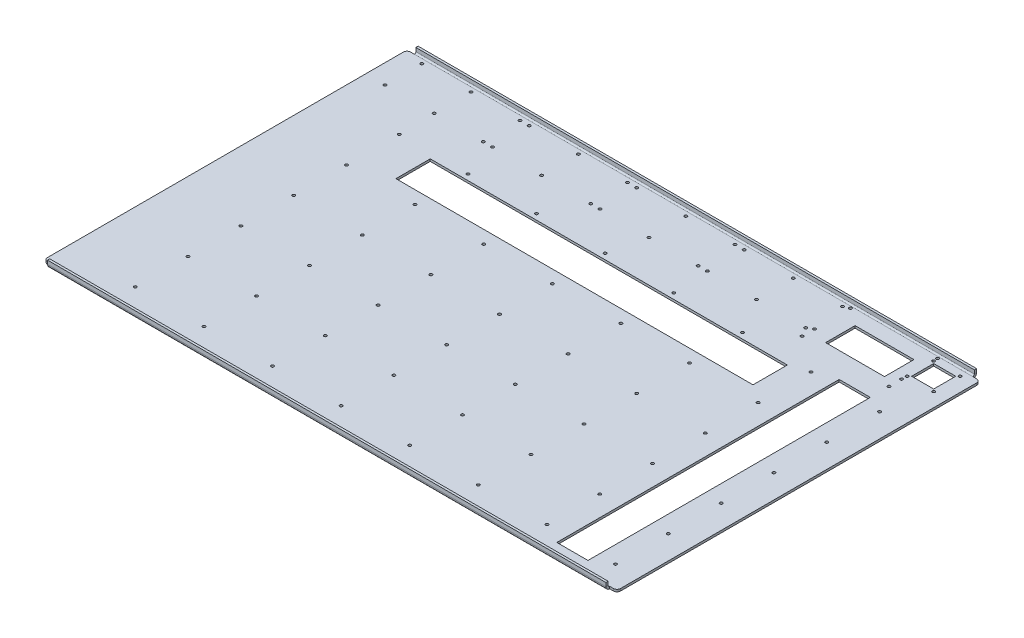
from build123d import *

# Parameters (mm, degrees)
SKETCH1_W                    = 481.838
SKETCH1_H                    = 315.9125
BASE_FLANGE1_DEPTH           = 1.9304
EDGE_FLANGE1_STRIP_W         = 10.2616
EDGE_FLANGE1_STRIP_H         = 1.9304
EDGE_FLANGE1_STRIP_CUT_DEPTH = 481.838
EDGE_FLANGE1_DEPTH           = 481.838
EDGE_FLANGE2_STRIP_W         = 10.2616
EDGE_FLANGE2_STRIP_H         = 1.9304
EDGE_FLANGE2_STRIP_CUT_DEPTH = 481.838
EDGE_FLANGE2_DEPTH           = 481.838
SKETCH11_W                   = 6.35
SKETCH11_H                   = 313.3725
TAB1_DEPTH                   = 1.9304
SKETCH12_W                   = 6.35
SKETCH12_H                   = 313.3725
TAB2_DEPTH                   = 1.9304
BREAK_CORNER1_START          = -1.9304
BREAK_CORNER1_DEPTH          = 1.9304
SKETCH17_R                   = 1.2192
CUT_EXTRUDE2_DEPTH           = 1.9304
SKETCH19_W                   = 19.05
SKETCH19_H                   = 19.05
CUT_EXTRUDE4_DEPTH           = 1.9304
SKETCH20_R                   = 1.2192
CUT_EXTRUDE5_DEPTH           = 1.9304
LPATTERN1_COUNT              = 2
LPATTERN1_PITCH              = 75.0316
LPATTERN1_COUNT_DIR2         = 2
LPATTERN1_PITCH_DIR2         = 30.988
SKETCH21_R                   = 1.2192
CUT_EXTRUDE6_DEPTH           = 1.9304
LPATTERN2_COUNT              = 3
LPATTERN2_PITCH              = 42.418
LPATTERN2_COUNT_DIR2         = 2
LPATTERN2_PITCH_DIR2         = 31.75
LPATTERN3_COUNT              = 4
LPATTERN3_PITCH              = 92.71
LPATTERN3_COPY_1_SKETCH_R    = 1.2192
LPATTERN3_COPY_1_DEPTH       = 1.9304
LPATTERN3_COPY_2_SKETCH_R    = 1.2192
LPATTERN3_COPY_2_DEPTH       = 1.9304
LPATTERN3_COPY_3_SKETCH_R    = 1.2192
LPATTERN3_COPY_3_DEPTH       = 1.9304
LPATTERN3_COPY_4_SKETCH_R    = 1.2192
LPATTERN3_COPY_4_DEPTH       = 1.9304
LPATTERN3_COPY_5_SKETCH_R    = 1.2192
LPATTERN3_COPY_5_DEPTH       = 1.9304
LPATTERN3_COPY_6_SKETCH_R    = 1.2192
LPATTERN3_COPY_6_DEPTH       = 1.9304
LPATTERN3_COPY_7_SKETCH_R    = 1.2192
LPATTERN3_COPY_7_DEPTH       = 1.9304
LPATTERN3_COPY_8_SKETCH_R    = 1.2192
LPATTERN3_COPY_8_DEPTH       = 1.9304
LPATTERN3_COPY_9_SKETCH_R    = 1.2192
LPATTERN3_COPY_9_DEPTH       = 1.9304
LPATTERN3_COPY_10_SKETCH_R   = 1.2192
LPATTERN3_COPY_10_DEPTH      = 1.9304
LPATTERN3_COPY_11_SKETCH_R   = 1.2192
LPATTERN3_COPY_11_DEPTH      = 1.9304
LPATTERN3_COPY_12_SKETCH_R   = 1.2192
LPATTERN3_COPY_12_DEPTH      = 1.9304
LPATTERN3_COPY_13_SKETCH_R   = 1.2192
LPATTERN3_COPY_13_DEPTH      = 1.9304
LPATTERN3_COPY_14_SKETCH_R   = 1.2192
LPATTERN3_COPY_14_DEPTH      = 1.9304
LPATTERN3_COPY_15_SKETCH_R   = 1.2192
LPATTERN3_COPY_15_DEPTH      = 1.9304
SKETCH22_R                   = 1.2192
CUT_EXTRUDE7_DEPTH           = 1.9304
LPATTERN4_COUNT              = 2
LPATTERN4_PITCH              = 75.0316
SKETCH23_R                   = 1.2192
CUT_EXTRUDE8_DEPTH           = 1.9304
LPATTERN5_COUNT              = 2
LPATTERN5_PITCH              = 22.86
LPATTERN5_COUNT_DIR2         = 2
LPATTERN5_PITCH_DIR2         = 22.86
SKETCH18_W                   = 50.8
SKETCH18_H                   = 25.4
CUT_EXTRUDE9_DEPTH           = 1.9304
SKETCH24_W                   = 308.123267001
SKETCH24_H                   = 29.610480988
SKETCH24_W_2                 = 26.871215145
SKETCH24_H_2                 = 243.632350652
CUT_EXTRUDE10_DEPTH          = 1.9304


# Read off the part's stored shape, not the designer's step: Break-Corner1
# Sheet-metal steps are written as plain solids
with BuildPart() as part:
    # Sketch1 → Base-Flange1 (new body)
    with BuildSketch(Plane(origin=(0, 0, 0), x_dir=(1, 0, 0), z_dir=(0, 1, 0))):
        with Locations((0, 5.55625)):
            Rectangle(SKETCH1_W, SKETCH1_H)
    extrude(amount=-BASE_FLANGE1_DEPTH)

    # Edge-Flange1 strip (across the edge) → Edge-Flange1 strip cut (cut)
    with BuildSketch(Plane(origin=(-240.919, 0, 152.4), x_dir=(0, 0, -1), z_dir=(1, 0, 0))):
        with Locations((-3.8608, -0.9652)):
            Rectangle(EDGE_FLANGE1_STRIP_W, EDGE_FLANGE1_STRIP_H)
    extrude(amount=EDGE_FLANGE1_STRIP_CUT_DEPTH, mode=Mode.SUBTRACT)

    # Edge-Flange1 section (across the edge) → Edge-Flange1 (add)
    with BuildSketch(Plane(origin=(-240.919, 0, 152.4), x_dir=(0, 0, -1), z_dir=(1, 0, 0))):
        with BuildLine():
            Line((-1.9304, 1.27), (-1.9304, 4.4196))
            Line((-1.9304, 4.4196), (0, 4.4196))
            Line((0, 4.4196), (0, 1.27))
            ThreePointArc((0, 1.27), (0.371974388, 0.371974388), (1.27, 0))
            Line((1.27, 0), (1.27, -1.9304))
            ThreePointArc((1.27, -1.9304), (-0.993024543, -0.993024543), (-1.9304, 1.27))
        make_face()
    extrude(amount=EDGE_FLANGE1_DEPTH)

    # Edge-Flange2 strip (across the edge) → Edge-Flange2 strip cut (cut)
    with BuildSketch(Plane(origin=(240.919, 0, -163.5125), x_dir=(0, 0, 1), z_dir=(-1, 0, 0))):
        with Locations((-3.8608, -0.9652)):
            Rectangle(EDGE_FLANGE2_STRIP_W, EDGE_FLANGE2_STRIP_H)
    extrude(amount=EDGE_FLANGE2_STRIP_CUT_DEPTH, mode=Mode.SUBTRACT)

    # Edge-Flange2 section (across the edge) → Edge-Flange2 (add)
    with BuildSketch(Plane(origin=(240.919, 0, -163.5125), x_dir=(0, 0, 1), z_dir=(-1, 0, 0))):
        with BuildLine():
            Line((-1.9304, 1.27), (-1.9304, 4.4196))
            Line((-1.9304, 4.4196), (0, 4.4196))
            Line((0, 4.4196), (0, 1.27))
            ThreePointArc((0, 1.27), (0.371974388, 0.371974388), (1.27, 0))
            Line((1.27, 0), (1.27, -1.9304))
            ThreePointArc((1.27, -1.9304), (-0.993024543, -0.993024543), (-1.9304, 1.27))
        make_face()
    extrude(amount=EDGE_FLANGE2_DEPTH)

    # Sketch11 → Tab1 (add)
    with BuildSketch(Plane(origin=(0, 0, 0), x_dir=(1, 0, 0), z_dir=(0, 1, 0))):
        with Locations((-244.094, 5.55625)):
            Rectangle(SKETCH11_W, SKETCH11_H)
    extrude(amount=-TAB1_DEPTH)

    # Sketch12 → Tab2 (add)
    with BuildSketch(Plane(origin=(0, 0, 0), x_dir=(1, 0, 0), z_dir=(0, 1, 0))):
        with Locations((244.094, 5.55625)):
            Rectangle(SKETCH12_W, SKETCH12_H)
    extrude(amount=-TAB2_DEPTH)

    # Break-Corner1 outline → Break-Corner1 (cut)
    with BuildSketch(Plane(origin=(0, 0, 0), x_dir=(1, 0, 0), z_dir=(0, 1, 0)).offset(BREAK_CORNER1_START)):
        with BuildLine():
            ThreePointArc((-244.094, -151.13), (-246.33906403, -150.20006403), (-247.269, -147.955))
            Line((-247.269, -147.955), (-247.269, -151.13))
            Line((-247.269, -151.13), (-244.094, -151.13))
        make_face()
        with BuildLine():
            ThreePointArc((-247.269, 159.0675), (-246.33906403, 161.31256403), (-244.094, 162.2425))
            Line((-244.094, 162.2425), (-247.269, 162.2425))
            Line((-247.269, 162.2425), (-247.269, 159.0675))
        make_face()
        with BuildLine():
            ThreePointArc((244.094, 162.2425), (246.33906403, 161.31256403), (247.269, 159.0675))
            Line((247.269, 159.0675), (247.269, 162.2425))
            Line((247.269, 162.2425), (244.094, 162.2425))
        make_face()
        with BuildLine():
            ThreePointArc((247.269, -147.955), (246.33906403, -150.20006403), (244.094, -151.13))
            Line((244.094, -151.13), (247.269, -151.13))
            Line((247.269, -151.13), (247.269, -147.955))
        make_face()
    extrude(amount=BREAK_CORNER1_DEPTH, mode=Mode.SUBTRACT)

    # Sketch17 → Cut-Extrude2 (cut)
    with BuildSketch(Plane(origin=(0, 0, 0), x_dir=(1, 0, 0), z_dir=(0, 1, 0))):
        with Locations(Location((226.926712262, 95.77140358, 0), (0, 0, 270))):
            Circle(SKETCH17_R)
        with Locations(Location((167.729472262, 95.77140358, 0), (0, 0, 270))):
            Circle(SKETCH17_R)
        with Locations(Location((108.532232262, 95.77140358, 0), (0, 0, 270))):
            Circle(SKETCH17_R)
        with Locations(Location((49.334992262, 95.77140358, 0), (0, 0, 270))):
            Circle(SKETCH17_R)
        with Locations(Location((-9.862247738, 95.77140358, 0), (0, 0, 270))):
            Circle(SKETCH17_R)
        with Locations(Location((-69.059487738, 95.77140358, 0), (0, 0, 270))):
            Circle(SKETCH17_R)
        with Locations(Location((-128.256727738, 95.77140358, 0), (0, 0, 270))):
            Circle(SKETCH17_R)
        with Locations(Location((-187.453967738, 95.77140358, 0), (0, 0, 270))):
            Circle(SKETCH17_R)
        with Locations(Location((226.926712262, 50.20380358, 0), (0, 0, 270))):
            Circle(SKETCH17_R)
        with Locations(Location((167.729472262, 50.20380358, 0), (0, 0, 270))):
            Circle(SKETCH17_R)
        with Locations(Location((108.532232262, 50.20380358, 0), (0, 0, 270))):
            Circle(SKETCH17_R)
        with Locations(Location((49.334992262, 50.20380358, 0), (0, 0, 270))):
            Circle(SKETCH17_R)
        with Locations(Location((-9.862247738, 50.20380358, 0), (0, 0, 270))):
            Circle(SKETCH17_R)
        with Locations(Location((-69.059487738, 50.20380358, 0), (0, 0, 270))):
            Circle(SKETCH17_R)
        with Locations(Location((-128.256727738, 50.20380358, 0), (0, 0, 270))):
            Circle(SKETCH17_R)
        with Locations(Location((-187.453967738, 50.20380358, 0), (0, 0, 270))):
            Circle(SKETCH17_R)
        with Locations(Location((226.926712262, 4.63620358, 0), (0, 0, 270))):
            Circle(SKETCH17_R)
        with Locations(Location((167.729472262, 4.63620358, 0), (0, 0, 270))):
            Circle(SKETCH17_R)
        with Locations(Location((108.532232262, 4.63620358, 0), (0, 0, 270))):
            Circle(SKETCH17_R)
        with Locations(Location((49.334992262, 4.63620358, 0), (0, 0, 270))):
            Circle(SKETCH17_R)
        with Locations(Location((-9.862247738, 4.63620358, 0), (0, 0, 270))):
            Circle(SKETCH17_R)
        with Locations(Location((-69.059487738, 4.63620358, 0), (0, 0, 270))):
            Circle(SKETCH17_R)
        with Locations(Location((-128.256727738, 4.63620358, 0), (0, 0, 270))):
            Circle(SKETCH17_R)
        with Locations(Location((-187.453967738, 4.63620358, 0), (0, 0, 270))):
            Circle(SKETCH17_R)
        with Locations(Location((226.926712262, -40.93139642, 0), (0, 0, 270))):
            Circle(SKETCH17_R)
        with Locations(Location((167.729472262, -40.93139642, 0), (0, 0, 270))):
            Circle(SKETCH17_R)
        with Locations(Location((108.532232262, -40.93139642, 0), (0, 0, 270))):
            Circle(SKETCH17_R)
        with Locations(Location((49.334992262, -40.93139642, 0), (0, 0, 270))):
            Circle(SKETCH17_R)
        with Locations(Location((-9.862247738, -40.93139642, 0), (0, 0, 270))):
            Circle(SKETCH17_R)
        with Locations(Location((-69.059487738, -40.93139642, 0), (0, 0, 270))):
            Circle(SKETCH17_R)
        with Locations(Location((-128.256727738, -40.93139642, 0), (0, 0, 270))):
            Circle(SKETCH17_R)
        with Locations(Location((-187.453967738, -40.93139642, 0), (0, 0, 270))):
            Circle(SKETCH17_R)
        with Locations(Location((226.926712262, -86.49899642, 0), (0, 0, 270))):
            Circle(SKETCH17_R)
        with Locations(Location((167.729472262, -86.49899642, 0), (0, 0, 270))):
            Circle(SKETCH17_R)
        with Locations(Location((108.532232262, -86.49899642, 0), (0, 0, 270))):
            Circle(SKETCH17_R)
        with Locations(Location((49.334992262, -86.49899642, 0), (0, 0, 270))):
            Circle(SKETCH17_R)
        with Locations(Location((-9.862247738, -86.49899642, 0), (0, 0, 270))):
            Circle(SKETCH17_R)
        with Locations(Location((-69.059487738, -86.49899642, 0), (0, 0, 270))):
            Circle(SKETCH17_R)
        with Locations(Location((-128.256727738, -86.49899642, 0), (0, 0, 270))):
            Circle(SKETCH17_R)
        with Locations(Location((-187.453967738, -86.49899642, 0), (0, 0, 270))):
            Circle(SKETCH17_R)
        with Locations(Location((226.926712262, -132.06659642, 0), (0, 0, 270))):
            Circle(SKETCH17_R)
        with Locations(Location((167.729472262, -132.06659642, 0), (0, 0, 270))):
            Circle(SKETCH17_R)
        with Locations(Location((108.532232262, -132.06659642, 0), (0, 0, 270))):
            Circle(SKETCH17_R)
        with Locations(Location((49.334992262, -132.06659642, 0), (0, 0, 270))):
            Circle(SKETCH17_R)
        with Locations(Location((-9.862247738, -132.06659642, 0), (0, 0, 270))):
            Circle(SKETCH17_R)
        with Locations(Location((-69.059487738, -132.06659642, 0), (0, 0, 270))):
            Circle(SKETCH17_R)
        with Locations(Location((-128.256727738, -132.06659642, 0), (0, 0, 270))):
            Circle(SKETCH17_R)
        with Locations(Location((-187.453967738, -132.06659642, 0), (0, 0, 270))):
            Circle(SKETCH17_R)
    extrude(amount=-CUT_EXTRUDE2_DEPTH, mode=Mode.SUBTRACT)

    # Sketch19 → Cut-Extrude4 (cut)
    with BuildSketch(Plane(origin=(0, 0, 0), x_dir=(-1, 0, 0), z_dir=(0, 1, 0))):
        with Locations((-223.7867, -145.617438)):
            Rectangle(SKETCH19_W, SKETCH19_H)
    extrude(amount=-CUT_EXTRUDE4_DEPTH, mode=Mode.SUBTRACT)

    # Sketch20 → Cut-Extrude5 (cut)
    with BuildSketch(Plane(origin=(0, 0, 0), x_dir=(-1, 0, 0), z_dir=(0, 1, 0))):
        with Locations(Location((-212.0646, -160.57118, 0), (0, 0, 90))):
            Circle(SKETCH20_R)
    cut_extrude5 = extrude(amount=-CUT_EXTRUDE5_DEPTH, mode=Mode.SUBTRACT)

    # LPattern1: Cut-Extrude5 2 × 2
    with Locations(*[(-i * LPATTERN1_PITCH, 0, j * LPATTERN1_PITCH_DIR2) for i in range(LPATTERN1_COUNT) for j in range(LPATTERN1_COUNT_DIR2) if (i, j) != (0, 0)]):
        add(cut_extrude5, mode=Mode.SUBTRACT)

    # Sketch21 → Cut-Extrude6 (cut)
    with BuildSketch(Plane(origin=(0, 0, 0), x_dir=(-1, 0, 0), z_dir=(0, 1, 0))):
        with Locations(Location((-132.3467, -158.32836, 0), (0, 0, 90))):
            Circle(SKETCH21_R)
    cut_extrude6 = extrude(amount=-CUT_EXTRUDE6_DEPTH, mode=Mode.SUBTRACT)

    # LPattern2: Cut-Extrude6 3 × 2
    with Locations(*[(-i * LPATTERN2_PITCH, 0, j * LPATTERN2_PITCH_DIR2) for i in range(LPATTERN2_COUNT) for j in range(LPATTERN2_COUNT_DIR2) if (i, j) != (0, 0)]):
        add(cut_extrude6, mode=Mode.SUBTRACT)

    # LPattern3: Cut-Extrude6 ×4
    with Locations(*[(-i * LPATTERN3_PITCH, 0, 0) for i in range(1, LPATTERN3_COUNT)]):
        add(cut_extrude6, mode=Mode.SUBTRACT)

    # LPattern3 copy 1 sketch → LPattern3 copy 1 (cut)
    with BuildSketch(Plane(origin=(-92.71, 0, 31.75), x_dir=(-1, 0, 0), z_dir=(0, 1, 0))):
        with Locations(Location((-132.3467, -158.32836, 0), (0, 0, 90))):
            Circle(LPATTERN3_COPY_1_SKETCH_R)
    extrude(amount=-LPATTERN3_COPY_1_DEPTH, mode=Mode.SUBTRACT)

    # LPattern3 copy 2 sketch → LPattern3 copy 2 (cut)
    with BuildSketch(Plane(origin=(-185.42, 0, 31.75), x_dir=(-1, 0, 0), z_dir=(0, 1, 0))):
        with Locations(Location((-132.3467, -158.32836, 0), (0, 0, 90))):
            Circle(LPATTERN3_COPY_2_SKETCH_R)
    extrude(amount=-LPATTERN3_COPY_2_DEPTH, mode=Mode.SUBTRACT)

    # LPattern3 copy 3 sketch → LPattern3 copy 3 (cut)
    with BuildSketch(Plane(origin=(-278.13, 0, 31.75), x_dir=(-1, 0, 0), z_dir=(0, 1, 0))):
        with Locations(Location((-132.3467, -158.32836, 0), (0, 0, 90))):
            Circle(LPATTERN3_COPY_3_SKETCH_R)
    extrude(amount=-LPATTERN3_COPY_3_DEPTH, mode=Mode.SUBTRACT)

    # LPattern3 copy 4 sketch → LPattern3 copy 4 (cut)
    with BuildSketch(Plane(origin=(-135.128, 0, 0), x_dir=(-1, 0, 0), z_dir=(0, 1, 0))):
        with Locations(Location((-132.3467, -158.32836, 0), (0, 0, 90))):
            Circle(LPATTERN3_COPY_4_SKETCH_R)
    extrude(amount=-LPATTERN3_COPY_4_DEPTH, mode=Mode.SUBTRACT)

    # LPattern3 copy 5 sketch → LPattern3 copy 5 (cut)
    with BuildSketch(Plane(origin=(-227.838, 0, 0), x_dir=(-1, 0, 0), z_dir=(0, 1, 0))):
        with Locations(Location((-132.3467, -158.32836, 0), (0, 0, 90))):
            Circle(LPATTERN3_COPY_5_SKETCH_R)
    extrude(amount=-LPATTERN3_COPY_5_DEPTH, mode=Mode.SUBTRACT)

    # LPattern3 copy 6 sketch → LPattern3 copy 6 (cut)
    with BuildSketch(Plane(origin=(-320.548, 0, 0), x_dir=(-1, 0, 0), z_dir=(0, 1, 0))):
        with Locations(Location((-132.3467, -158.32836, 0), (0, 0, 90))):
            Circle(LPATTERN3_COPY_6_SKETCH_R)
    extrude(amount=-LPATTERN3_COPY_6_DEPTH, mode=Mode.SUBTRACT)

    # LPattern3 copy 7 sketch → LPattern3 copy 7 (cut)
    with BuildSketch(Plane(origin=(-135.128, 0, 31.75), x_dir=(-1, 0, 0), z_dir=(0, 1, 0))):
        with Locations(Location((-132.3467, -158.32836, 0), (0, 0, 90))):
            Circle(LPATTERN3_COPY_7_SKETCH_R)
    extrude(amount=-LPATTERN3_COPY_7_DEPTH, mode=Mode.SUBTRACT)

    # LPattern3 copy 8 sketch → LPattern3 copy 8 (cut)
    with BuildSketch(Plane(origin=(-227.838, 0, 31.75), x_dir=(-1, 0, 0), z_dir=(0, 1, 0))):
        with Locations(Location((-132.3467, -158.32836, 0), (0, 0, 90))):
            Circle(LPATTERN3_COPY_8_SKETCH_R)
    extrude(amount=-LPATTERN3_COPY_8_DEPTH, mode=Mode.SUBTRACT)

    # LPattern3 copy 9 sketch → LPattern3 copy 9 (cut)
    with BuildSketch(Plane(origin=(-320.548, 0, 31.75), x_dir=(-1, 0, 0), z_dir=(0, 1, 0))):
        with Locations(Location((-132.3467, -158.32836, 0), (0, 0, 90))):
            Circle(LPATTERN3_COPY_9_SKETCH_R)
    extrude(amount=-LPATTERN3_COPY_9_DEPTH, mode=Mode.SUBTRACT)

    # LPattern3 copy 10 sketch → LPattern3 copy 10 (cut)
    with BuildSketch(Plane(origin=(-177.546, 0, 0), x_dir=(-1, 0, 0), z_dir=(0, 1, 0))):
        with Locations(Location((-132.3467, -158.32836, 0), (0, 0, 90))):
            Circle(LPATTERN3_COPY_10_SKETCH_R)
    extrude(amount=-LPATTERN3_COPY_10_DEPTH, mode=Mode.SUBTRACT)

    # LPattern3 copy 11 sketch → LPattern3 copy 11 (cut)
    with BuildSketch(Plane(origin=(-270.256, 0, 0), x_dir=(-1, 0, 0), z_dir=(0, 1, 0))):
        with Locations(Location((-132.3467, -158.32836, 0), (0, 0, 90))):
            Circle(LPATTERN3_COPY_11_SKETCH_R)
    extrude(amount=-LPATTERN3_COPY_11_DEPTH, mode=Mode.SUBTRACT)

    # LPattern3 copy 12 sketch → LPattern3 copy 12 (cut)
    with BuildSketch(Plane(origin=(-362.966, 0, 0), x_dir=(-1, 0, 0), z_dir=(0, 1, 0))):
        with Locations(Location((-132.3467, -158.32836, 0), (0, 0, 90))):
            Circle(LPATTERN3_COPY_12_SKETCH_R)
    extrude(amount=-LPATTERN3_COPY_12_DEPTH, mode=Mode.SUBTRACT)

    # LPattern3 copy 13 sketch → LPattern3 copy 13 (cut)
    with BuildSketch(Plane(origin=(-177.546, 0, 31.75), x_dir=(-1, 0, 0), z_dir=(0, 1, 0))):
        with Locations(Location((-132.3467, -158.32836, 0), (0, 0, 90))):
            Circle(LPATTERN3_COPY_13_SKETCH_R)
    extrude(amount=-LPATTERN3_COPY_13_DEPTH, mode=Mode.SUBTRACT)

    # LPattern3 copy 14 sketch → LPattern3 copy 14 (cut)
    with BuildSketch(Plane(origin=(-270.256, 0, 31.75), x_dir=(-1, 0, 0), z_dir=(0, 1, 0))):
        with Locations(Location((-132.3467, -158.32836, 0), (0, 0, 90))):
            Circle(LPATTERN3_COPY_14_SKETCH_R)
    extrude(amount=-LPATTERN3_COPY_14_DEPTH, mode=Mode.SUBTRACT)

    # LPattern3 copy 15 sketch → LPattern3 copy 15 (cut)
    with BuildSketch(Plane(origin=(-362.966, 0, 31.75), x_dir=(-1, 0, 0), z_dir=(0, 1, 0))):
        with Locations(Location((-132.3467, -158.32836, 0), (0, 0, 90))):
            Circle(LPATTERN3_COPY_15_SKETCH_R)
    extrude(amount=-LPATTERN3_COPY_15_DEPTH, mode=Mode.SUBTRACT)

    # Sketch22 → Cut-Extrude7 (cut)
    with BuildSketch(Plane(origin=(0, 0, 0), x_dir=(-1, 0, 0), z_dir=(0, 1, 0))):
        with Locations(Location((-212.0646, -118.7704, 0), (0, 0, 90))):
            Circle(SKETCH22_R)
    cut_extrude7 = extrude(amount=-CUT_EXTRUDE7_DEPTH, mode=Mode.SUBTRACT)

    # LPattern4: Cut-Extrude7 ×2
    with Locations(*[(-i * LPATTERN4_PITCH, 0, 0) for i in range(1, LPATTERN4_COUNT)]):
        add(cut_extrude7, mode=Mode.SUBTRACT)

    # Sketch23 → Cut-Extrude8 (cut)
    with BuildSketch(Plane(origin=(0, 0, 0), x_dir=(-1, 0, 0), z_dir=(0, 1, 0))):
        with Locations(Location((-212.3567, -157.047438, 0), (0, 0, 90))):
            Circle(SKETCH23_R)
    cut_extrude8 = extrude(amount=-CUT_EXTRUDE8_DEPTH, mode=Mode.SUBTRACT)

    # LPattern5: Cut-Extrude8 2 × 2
    with Locations(*[(i * LPATTERN5_PITCH, 0, j * LPATTERN5_PITCH_DIR2) for i in range(LPATTERN5_COUNT) for j in range(LPATTERN5_COUNT_DIR2) if (i, j) != (0, 0)]):
        add(cut_extrude8, mode=Mode.SUBTRACT)

    # Sketch18 → Cut-Extrude9 (cut)
    with BuildSketch(Plane(origin=(0, 0, 0), x_dir=(1, 0, 0), z_dir=(0, 1, 0))):
        with Locations((177.419, 136.8425)):
            Rectangle(SKETCH18_W, SKETCH18_H)
    extrude(amount=-CUT_EXTRUDE9_DEPTH, mode=Mode.SUBTRACT)

    # Sketch24 → Cut-Extrude10 (cut)
    with BuildSketch(Plane(origin=(0, 0, 0), x_dir=(-1, 0, 0), z_dir=(0, 1, 0))):
        with Locations((1.818026518, -76.08236836)):
            Rectangle(SKETCH24_W, SKETCH24_H)
        with Locations((-198.820379901, 19.33651757)):
            Rectangle(SKETCH24_W_2, SKETCH24_H_2)
    extrude(amount=-CUT_EXTRUDE10_DEPTH, mode=Mode.SUBTRACT)


solid = part.part
